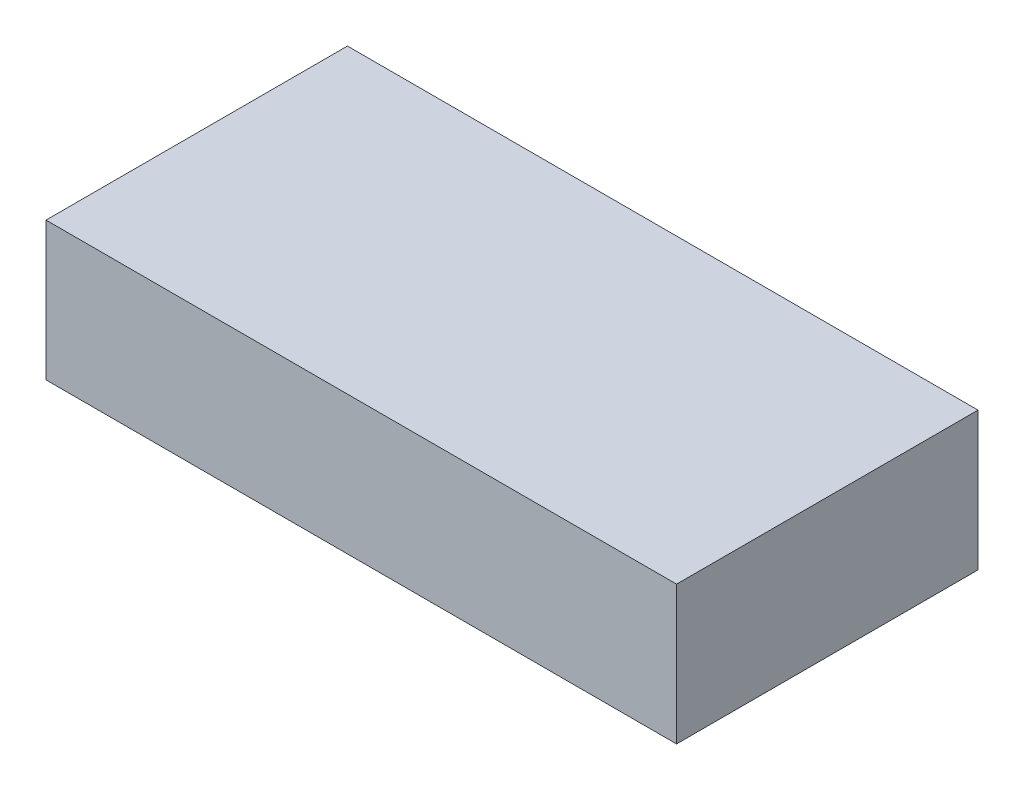
from build123d import *

# Parameters (mm, degrees)
SKETCH1_W           = 205
SKETCH1_H           = 98
BOSS_EXTRUDE1_DEPTH = 45


with BuildPart() as part:
    # Sketch1 → Boss-Extrude1 (new body)
    with BuildSketch(Plane(origin=(0, 0, 0), x_dir=(1, 0, 0), z_dir=(0, 1, 0))):
        Rectangle(SKETCH1_W, SKETCH1_H)
    extrude(amount=BOSS_EXTRUDE1_DEPTH)


solid = part.part
